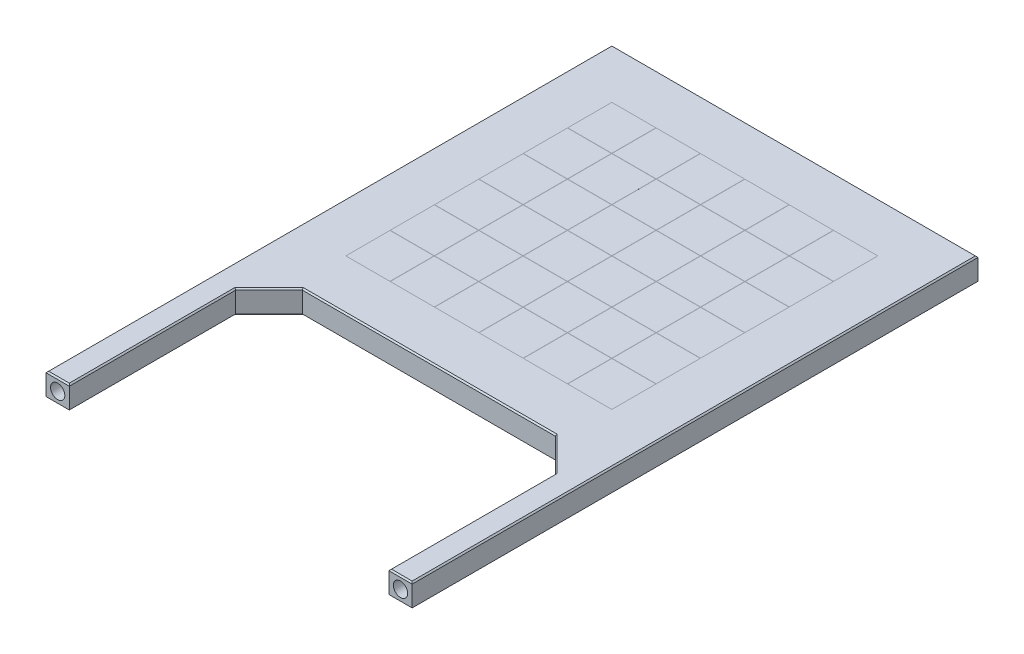
from build123d import *

# Parameters (mm, degrees)
SKETCH1_W              = 110
SKETCH1_H              = 110
BOSS_EXTRUDE1_DEPTH    = 7
SKETCH2_W              = 7
SKETCH2_H              = 60
BOSS_EXTRUDE3_DEPTH    = 7
SKETCH4_R              = 2.15
CUT_EXTRUDE2_DEPTH     = 10
SKETCH7_W              = 13.253333333
SKETCH7_H              = 13.253333333
CUT_EXTRUDE3_DEPTH     = 1
SKETCH7_2_W            = 13.253333333
SKETCH7_2_H            = 13.253333333
BOSS_EXTRUDE4_DEPTH    = 1
BOSS_EXTRUDE4_2_DEPTH  = 1
BOSS_EXTRUDE4_3_DEPTH  = 1
BOSS_EXTRUDE4_4_DEPTH  = 1
BOSS_EXTRUDE4_5_DEPTH  = 1
BOSS_EXTRUDE4_6_DEPTH  = 1
BOSS_EXTRUDE4_7_DEPTH  = 1
BOSS_EXTRUDE4_8_DEPTH  = 1
BOSS_EXTRUDE4_9_DEPTH  = 1
BOSS_EXTRUDE4_10_DEPTH = 1
BOSS_EXTRUDE4_11_DEPTH = 1
BOSS_EXTRUDE4_12_DEPTH = 1
BOSS_EXTRUDE4_13_DEPTH = 1
BOSS_EXTRUDE4_14_DEPTH = 1
BOSS_EXTRUDE4_15_DEPTH = 1
BOSS_EXTRUDE4_16_DEPTH = 1
BOSS_EXTRUDE4_17_DEPTH = 1
BOSS_EXTRUDE4_18_DEPTH = 1
BOSS_EXTRUDE4_19_DEPTH = 1
BOSS_EXTRUDE4_20_DEPTH = 1
BOSS_EXTRUDE4_21_DEPTH = 1
BOSS_EXTRUDE4_22_DEPTH = 1
BOSS_EXTRUDE4_23_DEPTH = 1
BOSS_EXTRUDE4_24_DEPTH = 1
BOSS_EXTRUDE4_25_DEPTH = 1
BOSS_EXTRUDE4_26_DEPTH = 1
BOSS_EXTRUDE4_27_DEPTH = 1
BOSS_EXTRUDE4_28_DEPTH = 1
BOSS_EXTRUDE4_29_DEPTH = 1
BOSS_EXTRUDE4_30_DEPTH = 1
BOSS_EXTRUDE4_31_DEPTH = 1
BOSS_EXTRUDE4_32_DEPTH = 1
BOSS_EXTRUDE4_33_DEPTH = 1
BOSS_EXTRUDE4_34_DEPTH = 1
BOSS_EXTRUDE4_35_DEPTH = 1
BOSS_EXTRUDE4_36_DEPTH = 1
CUT_EXTRUDE4_START     = -7
SKETCH7_3_W            = 13.253333333
SKETCH7_3_H            = 13.253333333
CUT_EXTRUDE4_DEPTH     = 1
BOSS_EXTRUDE5_START    = -7
SKETCH7_4_W            = 13.253333333
SKETCH7_4_H            = 13.253333333
BOSS_EXTRUDE5_DEPTH    = 1
BOSS_EXTRUDE5_2_DEPTH  = 1
BOSS_EXTRUDE5_3_DEPTH  = 1
BOSS_EXTRUDE5_4_DEPTH  = 1
BOSS_EXTRUDE5_5_DEPTH  = 1
BOSS_EXTRUDE5_6_DEPTH  = 1
BOSS_EXTRUDE5_7_DEPTH  = 1
BOSS_EXTRUDE5_8_DEPTH  = 1
BOSS_EXTRUDE5_9_DEPTH  = 1
BOSS_EXTRUDE5_10_DEPTH = 1
BOSS_EXTRUDE5_11_DEPTH = 1
BOSS_EXTRUDE5_12_DEPTH = 1
BOSS_EXTRUDE5_13_DEPTH = 1
BOSS_EXTRUDE5_14_DEPTH = 1
BOSS_EXTRUDE5_15_DEPTH = 1
BOSS_EXTRUDE5_16_DEPTH = 1
BOSS_EXTRUDE5_17_DEPTH = 1
BOSS_EXTRUDE5_18_DEPTH = 1
BOSS_EXTRUDE5_19_DEPTH = 1
BOSS_EXTRUDE5_20_DEPTH = 1
BOSS_EXTRUDE5_21_DEPTH = 1
BOSS_EXTRUDE5_22_DEPTH = 1
BOSS_EXTRUDE5_23_DEPTH = 1
BOSS_EXTRUDE5_24_DEPTH = 1
BOSS_EXTRUDE5_25_DEPTH = 1
BOSS_EXTRUDE5_26_DEPTH = 1
BOSS_EXTRUDE5_27_DEPTH = 1
BOSS_EXTRUDE5_28_DEPTH = 1
BOSS_EXTRUDE5_29_DEPTH = 1
BOSS_EXTRUDE5_30_DEPTH = 1
BOSS_EXTRUDE5_31_DEPTH = 1
BOSS_EXTRUDE5_32_DEPTH = 1
BOSS_EXTRUDE5_33_DEPTH = 1
BOSS_EXTRUDE5_34_DEPTH = 1
BOSS_EXTRUDE5_35_DEPTH = 1
BOSS_EXTRUDE5_36_DEPTH = 1
CHAMFER1_SIZE          = 10
CHAMFER2_SIZE          = 0.4


with BuildPart() as part:
    # Sketch1 → Boss-Extrude1 (new body)
    with BuildSketch(Plane(origin=(0, 0, 0), x_dir=(1, 0, 0), z_dir=(0, 1, 0))):
        Rectangle(SKETCH1_W, SKETCH1_H)
    extrude(amount=BOSS_EXTRUDE1_DEPTH)

    # Sketch2 → Boss-Extrude3 (add)
    with BuildSketch(Plane(origin=(0, 7, 0), x_dir=(1, 0, 0), z_dir=(0, 1, 0))):
        with Locations((-51.5, -85)):
            Rectangle(SKETCH2_W, SKETCH2_H)
        with Locations((51.5, -85)):
            Rectangle(SKETCH2_W, SKETCH2_H)
    extrude(amount=-BOSS_EXTRUDE3_DEPTH)

    # Sketch4 → Cut-Extrude2 (cut)
    with BuildSketch(Plane.XY.offset(115)):
        with Locations((-51.5, 3.5)):
            Circle(SKETCH4_R)
        with Locations((51.5, 3.5)):
            Circle(SKETCH4_R)
    extrude(amount=-CUT_EXTRUDE2_DEPTH, mode=Mode.SUBTRACT)

    # Sketch7 → Cut-Extrude3 (cut)
    with BuildSketch(Plane.XZ):
        with Locations((-20.003333334, 33.333333334)):
            Rectangle(SKETCH7_W, SKETCH7_H)
        with Locations((-33.333333334, 33.333333334)):
            Rectangle(SKETCH7_W, SKETCH7_H)
        with Locations((-6.673333334, 33.333333334)):
            Rectangle(SKETCH7_W, SKETCH7_H)
        with Locations((6.656666667, 33.333333334)):
            Rectangle(SKETCH7_W, SKETCH7_H)
        with Locations((19.986666666, 33.333333334)):
            Rectangle(SKETCH7_W, SKETCH7_H)
        with Locations((33.316666667, 33.333333334)):
            Rectangle(SKETCH7_W, SKETCH7_H)
        with Locations((-20.003333334, 20.003333334)):
            Rectangle(SKETCH7_W, SKETCH7_H)
        with Locations((-6.673333334, 20.003333334)):
            Rectangle(SKETCH7_W, SKETCH7_H)
        with Locations((6.656666667, 20.003333334)):
            Rectangle(SKETCH7_W, SKETCH7_H)
        with Locations((19.986666666, 20.003333334)):
            Rectangle(SKETCH7_W, SKETCH7_H)
        with Locations((33.316666667, 20.003333334)):
            Rectangle(SKETCH7_W, SKETCH7_H)
        with Locations((-20.003333334, 6.673333334)):
            Rectangle(SKETCH7_W, SKETCH7_H)
        with Locations((-6.673333334, 6.673333334)):
            Rectangle(SKETCH7_W, SKETCH7_H)
        with Locations((6.656666667, 6.673333334)):
            Rectangle(SKETCH7_W, SKETCH7_H)
        with Locations((19.986666666, 6.673333334)):
            Rectangle(SKETCH7_W, SKETCH7_H)
        with Locations((33.316666667, 6.673333334)):
            Rectangle(SKETCH7_W, SKETCH7_H)
        with Locations((-20.003333334, -6.656666667)):
            Rectangle(SKETCH7_W, SKETCH7_H)
        with Locations((-6.673333334, -6.656666667)):
            Rectangle(SKETCH7_W, SKETCH7_H)
        with Locations((6.656666667, -6.656666667)):
            Rectangle(SKETCH7_W, SKETCH7_H)
        with Locations((19.986666666, -6.656666667)):
            Rectangle(SKETCH7_W, SKETCH7_H)
        with Locations((33.316666667, -6.656666667)):
            Rectangle(SKETCH7_W, SKETCH7_H)
        with Locations((-20.003333334, -19.986666666)):
            Rectangle(SKETCH7_W, SKETCH7_H)
        with Locations((-6.673333334, -19.986666666)):
            Rectangle(SKETCH7_W, SKETCH7_H)
        with Locations((6.656666667, -19.986666666)):
            Rectangle(SKETCH7_W, SKETCH7_H)
        with Locations((19.986666666, -19.986666666)):
            Rectangle(SKETCH7_W, SKETCH7_H)
        with Locations((33.316666667, -19.986666666)):
            Rectangle(SKETCH7_W, SKETCH7_H)
        with Locations((-20.003333334, -33.316666667)):
            Rectangle(SKETCH7_W, SKETCH7_H)
        with Locations((-6.673333334, -33.316666667)):
            Rectangle(SKETCH7_W, SKETCH7_H)
        with Locations((6.656666667, -33.316666667)):
            Rectangle(SKETCH7_W, SKETCH7_H)
        with Locations((19.986666666, -33.316666667)):
            Rectangle(SKETCH7_W, SKETCH7_H)
        with Locations((33.316666667, -33.316666667)):
            Rectangle(SKETCH7_W, SKETCH7_H)
        with Locations((-33.333333334, 20.003333334)):
            Rectangle(SKETCH7_W, SKETCH7_H)
        with Locations((-33.333333334, 6.673333334)):
            Rectangle(SKETCH7_W, SKETCH7_H)
        with Locations((-33.333333334, -6.656666667)):
            Rectangle(SKETCH7_W, SKETCH7_H)
        with Locations((-33.333333334, -19.986666666)):
            Rectangle(SKETCH7_W, SKETCH7_H)
        with Locations((-33.333333334, -33.316666667)):
            Rectangle(SKETCH7_W, SKETCH7_H)
    extrude(amount=-CUT_EXTRUDE3_DEPTH, mode=Mode.SUBTRACT)

    # Sketch7<3> → Cut-Extrude4 (cut)
    with BuildSketch(Plane.XZ.offset(CUT_EXTRUDE4_START)):
        with Locations((-20.003333334, 33.333333334)):
            Rectangle(SKETCH7_3_W, SKETCH7_3_H)
        with Locations((-33.333333334, 33.333333334)):
            Rectangle(SKETCH7_3_W, SKETCH7_3_H)
        with Locations((-6.673333334, 33.333333334)):
            Rectangle(SKETCH7_3_W, SKETCH7_3_H)
        with Locations((6.656666667, 33.333333334)):
            Rectangle(SKETCH7_3_W, SKETCH7_3_H)
        with Locations((19.986666666, 33.333333334)):
            Rectangle(SKETCH7_3_W, SKETCH7_3_H)
        with Locations((33.316666667, 33.333333334)):
            Rectangle(SKETCH7_3_W, SKETCH7_3_H)
        with Locations((-20.003333334, 20.003333334)):
            Rectangle(SKETCH7_3_W, SKETCH7_3_H)
        with Locations((-6.673333334, 20.003333334)):
            Rectangle(SKETCH7_3_W, SKETCH7_3_H)
        with Locations((6.656666667, 20.003333334)):
            Rectangle(SKETCH7_3_W, SKETCH7_3_H)
        with Locations((19.986666666, 20.003333334)):
            Rectangle(SKETCH7_3_W, SKETCH7_3_H)
        with Locations((33.316666667, 20.003333334)):
            Rectangle(SKETCH7_3_W, SKETCH7_3_H)
        with Locations((-20.003333334, 6.673333334)):
            Rectangle(SKETCH7_3_W, SKETCH7_3_H)
        with Locations((-6.673333334, 6.673333334)):
            Rectangle(SKETCH7_3_W, SKETCH7_3_H)
        with Locations((6.656666667, 6.673333334)):
            Rectangle(SKETCH7_3_W, SKETCH7_3_H)
        with Locations((19.986666666, 6.673333334)):
            Rectangle(SKETCH7_3_W, SKETCH7_3_H)
        with Locations((33.316666667, 6.673333334)):
            Rectangle(SKETCH7_3_W, SKETCH7_3_H)
        with Locations((-20.003333334, -6.656666667)):
            Rectangle(SKETCH7_3_W, SKETCH7_3_H)
        with Locations((-6.673333334, -6.656666667)):
            Rectangle(SKETCH7_3_W, SKETCH7_3_H)
        with Locations((6.656666667, -6.656666667)):
            Rectangle(SKETCH7_3_W, SKETCH7_3_H)
        with Locations((19.986666666, -6.656666667)):
            Rectangle(SKETCH7_3_W, SKETCH7_3_H)
        with Locations((33.316666667, -6.656666667)):
            Rectangle(SKETCH7_3_W, SKETCH7_3_H)
        with Locations((-20.003333334, -19.986666666)):
            Rectangle(SKETCH7_3_W, SKETCH7_3_H)
        with Locations((-6.673333334, -19.986666666)):
            Rectangle(SKETCH7_3_W, SKETCH7_3_H)
        with Locations((6.656666667, -19.986666666)):
            Rectangle(SKETCH7_3_W, SKETCH7_3_H)
        with Locations((19.986666666, -19.986666666)):
            Rectangle(SKETCH7_3_W, SKETCH7_3_H)
        with Locations((33.316666667, -19.986666666)):
            Rectangle(SKETCH7_3_W, SKETCH7_3_H)
        with Locations((-20.003333334, -33.316666667)):
            Rectangle(SKETCH7_3_W, SKETCH7_3_H)
        with Locations((-6.673333334, -33.316666667)):
            Rectangle(SKETCH7_3_W, SKETCH7_3_H)
        with Locations((6.656666667, -33.316666667)):
            Rectangle(SKETCH7_3_W, SKETCH7_3_H)
        with Locations((19.986666666, -33.316666667)):
            Rectangle(SKETCH7_3_W, SKETCH7_3_H)
        with Locations((33.316666667, -33.316666667)):
            Rectangle(SKETCH7_3_W, SKETCH7_3_H)
        with Locations((-33.333333334, 20.003333334)):
            Rectangle(SKETCH7_3_W, SKETCH7_3_H)
        with Locations((-33.333333334, 6.673333334)):
            Rectangle(SKETCH7_3_W, SKETCH7_3_H)
        with Locations((-33.333333334, -6.656666667)):
            Rectangle(SKETCH7_3_W, SKETCH7_3_H)
        with Locations((-33.333333334, -19.986666666)):
            Rectangle(SKETCH7_3_W, SKETCH7_3_H)
        with Locations((-33.333333334, -33.316666667)):
            Rectangle(SKETCH7_3_W, SKETCH7_3_H)
    extrude(amount=CUT_EXTRUDE4_DEPTH, mode=Mode.SUBTRACT)

    # Chamfer1
    chamfer1_edges = [part.edges().sort_by_distance(p)[0] for p in [
        (-48, 3.5, 55),
        (48, 3.5, 55),
    ]]
    chamfer(chamfer1_edges, length=CHAMFER1_SIZE)

    # Chamfer2
    chamfer2_edges = [part.edges().sort_by_distance(p)[0] for p in [
        (-55, 7, 30),
        (-51.5, 7, 115),
        (-48, 7, 90),
        (-51.5, 0, 115),
        (-48, 0, 90),
        (51.5, 7, 115),
        (51.5, 0, 115),
        (55, 7, 30),
        (-55, 0, 30),
        (0, 0, -55),
        (55, 0, 30),
        (0, 7, -55),
        (0, 0, 55),
        (0, 7, 55),
        (48, 0, 90),
        (48, 7, 90),
        (-43, 7, 60),
        (-43, 0, 60),
        (43, 7, 60),
        (43, 0, 60),
    ]]
    chamfer(chamfer2_edges, length=CHAMFER2_SIZE)


with BuildPart() as body_2:
    # Sketch7<2> → Boss-Extrude4 (new body)
    with BuildSketch(Plane.XZ):
        with Locations((-20.003333334, 33.333333334)):
            Rectangle(SKETCH7_2_W, SKETCH7_2_H)
    extrude(amount=-BOSS_EXTRUDE4_DEPTH)


with BuildPart() as body_3:
    # Sketch7<2> → Boss-Extrude4 2 (new body)
    with BuildSketch(Plane.XZ):
        with Locations((-33.333333334, 33.333333334)):
            Rectangle(SKETCH7_2_W, SKETCH7_2_H)
    extrude(amount=-BOSS_EXTRUDE4_2_DEPTH)


with BuildPart() as body_4:
    # Sketch7<2> → Boss-Extrude4 3 (new body)
    with BuildSketch(Plane.XZ):
        with Locations((-6.673333334, 33.333333334)):
            Rectangle(SKETCH7_2_W, SKETCH7_2_H)
    extrude(amount=-BOSS_EXTRUDE4_3_DEPTH)


with BuildPart() as body_5:
    # Sketch7<2> → Boss-Extrude4 4 (new body)
    with BuildSketch(Plane.XZ):
        with Locations((6.656666667, 33.333333334)):
            Rectangle(SKETCH7_2_W, SKETCH7_2_H)
    extrude(amount=-BOSS_EXTRUDE4_4_DEPTH)


with BuildPart() as body_6:
    # Sketch7<2> → Boss-Extrude4 5 (new body)
    with BuildSketch(Plane.XZ):
        with Locations((19.986666666, 33.333333334)):
            Rectangle(SKETCH7_2_W, SKETCH7_2_H)
    extrude(amount=-BOSS_EXTRUDE4_5_DEPTH)


with BuildPart() as body_7:
    # Sketch7<2> → Boss-Extrude4 6 (new body)
    with BuildSketch(Plane.XZ):
        with Locations((33.316666667, 33.333333334)):
            Rectangle(SKETCH7_2_W, SKETCH7_2_H)
    extrude(amount=-BOSS_EXTRUDE4_6_DEPTH)


with BuildPart() as body_8:
    # Sketch7<2> → Boss-Extrude4 7 (new body)
    with BuildSketch(Plane.XZ):
        with Locations((-20.003333334, 20.003333334)):
            Rectangle(SKETCH7_2_W, SKETCH7_2_H)
    extrude(amount=-BOSS_EXTRUDE4_7_DEPTH)


with BuildPart() as body_9:
    # Sketch7<2> → Boss-Extrude4 8 (new body)
    with BuildSketch(Plane.XZ):
        with Locations((-6.673333334, 20.003333334)):
            Rectangle(SKETCH7_2_W, SKETCH7_2_H)
    extrude(amount=-BOSS_EXTRUDE4_8_DEPTH)


with BuildPart() as body_10:
    # Sketch7<2> → Boss-Extrude4 9 (new body)
    with BuildSketch(Plane.XZ):
        with Locations((6.656666667, 20.003333334)):
            Rectangle(SKETCH7_2_W, SKETCH7_2_H)
    extrude(amount=-BOSS_EXTRUDE4_9_DEPTH)


with BuildPart() as body_11:
    # Sketch7<2> → Boss-Extrude4 10 (new body)
    with BuildSketch(Plane.XZ):
        with Locations((19.986666666, 20.003333334)):
            Rectangle(SKETCH7_2_W, SKETCH7_2_H)
    extrude(amount=-BOSS_EXTRUDE4_10_DEPTH)


with BuildPart() as body_12:
    # Sketch7<2> → Boss-Extrude4 11 (new body)
    with BuildSketch(Plane.XZ):
        with Locations((33.316666667, 20.003333334)):
            Rectangle(SKETCH7_2_W, SKETCH7_2_H)
    extrude(amount=-BOSS_EXTRUDE4_11_DEPTH)


with BuildPart() as body_13:
    # Sketch7<2> → Boss-Extrude4 12 (new body)
    with BuildSketch(Plane.XZ):
        with Locations((-20.003333334, 6.673333334)):
            Rectangle(SKETCH7_2_W, SKETCH7_2_H)
    extrude(amount=-BOSS_EXTRUDE4_12_DEPTH)


with BuildPart() as body_14:
    # Sketch7<2> → Boss-Extrude4 13 (new body)
    with BuildSketch(Plane.XZ):
        with Locations((-6.673333334, 6.673333334)):
            Rectangle(SKETCH7_2_W, SKETCH7_2_H)
    extrude(amount=-BOSS_EXTRUDE4_13_DEPTH)


with BuildPart() as body_15:
    # Sketch7<2> → Boss-Extrude4 14 (new body)
    with BuildSketch(Plane.XZ):
        with Locations((6.656666667, 6.673333334)):
            Rectangle(SKETCH7_2_W, SKETCH7_2_H)
    extrude(amount=-BOSS_EXTRUDE4_14_DEPTH)


with BuildPart() as body_16:
    # Sketch7<2> → Boss-Extrude4 15 (new body)
    with BuildSketch(Plane.XZ):
        with Locations((19.986666666, 6.673333334)):
            Rectangle(SKETCH7_2_W, SKETCH7_2_H)
    extrude(amount=-BOSS_EXTRUDE4_15_DEPTH)


with BuildPart() as body_17:
    # Sketch7<2> → Boss-Extrude4 16 (new body)
    with BuildSketch(Plane.XZ):
        with Locations((33.316666667, 6.673333334)):
            Rectangle(SKETCH7_2_W, SKETCH7_2_H)
    extrude(amount=-BOSS_EXTRUDE4_16_DEPTH)


with BuildPart() as body_18:
    # Sketch7<2> → Boss-Extrude4 17 (new body)
    with BuildSketch(Plane.XZ):
        with Locations((-20.003333334, -6.656666667)):
            Rectangle(SKETCH7_2_W, SKETCH7_2_H)
    extrude(amount=-BOSS_EXTRUDE4_17_DEPTH)


with BuildPart() as body_19:
    # Sketch7<2> → Boss-Extrude4 18 (new body)
    with BuildSketch(Plane.XZ):
        with Locations((-6.673333334, -6.656666667)):
            Rectangle(SKETCH7_2_W, SKETCH7_2_H)
    extrude(amount=-BOSS_EXTRUDE4_18_DEPTH)


with BuildPart() as body_20:
    # Sketch7<2> → Boss-Extrude4 19 (new body)
    with BuildSketch(Plane.XZ):
        with Locations((6.656666667, -6.656666667)):
            Rectangle(SKETCH7_2_W, SKETCH7_2_H)
    extrude(amount=-BOSS_EXTRUDE4_19_DEPTH)


with BuildPart() as body_21:
    # Sketch7<2> → Boss-Extrude4 20 (new body)
    with BuildSketch(Plane.XZ):
        with Locations((19.986666666, -6.656666667)):
            Rectangle(SKETCH7_2_W, SKETCH7_2_H)
    extrude(amount=-BOSS_EXTRUDE4_20_DEPTH)


with BuildPart() as body_22:
    # Sketch7<2> → Boss-Extrude4 21 (new body)
    with BuildSketch(Plane.XZ):
        with Locations((33.316666667, -6.656666667)):
            Rectangle(SKETCH7_2_W, SKETCH7_2_H)
    extrude(amount=-BOSS_EXTRUDE4_21_DEPTH)


with BuildPart() as body_23:
    # Sketch7<2> → Boss-Extrude4 22 (new body)
    with BuildSketch(Plane.XZ):
        with Locations((-20.003333334, -19.986666666)):
            Rectangle(SKETCH7_2_W, SKETCH7_2_H)
    extrude(amount=-BOSS_EXTRUDE4_22_DEPTH)


with BuildPart() as body_24:
    # Sketch7<2> → Boss-Extrude4 23 (new body)
    with BuildSketch(Plane.XZ):
        with Locations((-6.673333334, -19.986666666)):
            Rectangle(SKETCH7_2_W, SKETCH7_2_H)
    extrude(amount=-BOSS_EXTRUDE4_23_DEPTH)


with BuildPart() as body_25:
    # Sketch7<2> → Boss-Extrude4 24 (new body)
    with BuildSketch(Plane.XZ):
        with Locations((6.656666667, -19.986666666)):
            Rectangle(SKETCH7_2_W, SKETCH7_2_H)
    extrude(amount=-BOSS_EXTRUDE4_24_DEPTH)


with BuildPart() as body_26:
    # Sketch7<2> → Boss-Extrude4 25 (new body)
    with BuildSketch(Plane.XZ):
        with Locations((19.986666666, -19.986666666)):
            Rectangle(SKETCH7_2_W, SKETCH7_2_H)
    extrude(amount=-BOSS_EXTRUDE4_25_DEPTH)


with BuildPart() as body_27:
    # Sketch7<2> → Boss-Extrude4 26 (new body)
    with BuildSketch(Plane.XZ):
        with Locations((33.316666667, -19.986666666)):
            Rectangle(SKETCH7_2_W, SKETCH7_2_H)
    extrude(amount=-BOSS_EXTRUDE4_26_DEPTH)


with BuildPart() as body_28:
    # Sketch7<2> → Boss-Extrude4 27 (new body)
    with BuildSketch(Plane.XZ):
        with Locations((-20.003333334, -33.316666667)):
            Rectangle(SKETCH7_2_W, SKETCH7_2_H)
    extrude(amount=-BOSS_EXTRUDE4_27_DEPTH)


with BuildPart() as body_29:
    # Sketch7<2> → Boss-Extrude4 28 (new body)
    with BuildSketch(Plane.XZ):
        with Locations((-6.673333334, -33.316666667)):
            Rectangle(SKETCH7_2_W, SKETCH7_2_H)
    extrude(amount=-BOSS_EXTRUDE4_28_DEPTH)


with BuildPart() as body_30:
    # Sketch7<2> → Boss-Extrude4 29 (new body)
    with BuildSketch(Plane.XZ):
        with Locations((6.656666667, -33.316666667)):
            Rectangle(SKETCH7_2_W, SKETCH7_2_H)
    extrude(amount=-BOSS_EXTRUDE4_29_DEPTH)


with BuildPart() as body_31:
    # Sketch7<2> → Boss-Extrude4 30 (new body)
    with BuildSketch(Plane.XZ):
        with Locations((19.986666666, -33.316666667)):
            Rectangle(SKETCH7_2_W, SKETCH7_2_H)
    extrude(amount=-BOSS_EXTRUDE4_30_DEPTH)


with BuildPart() as body_32:
    # Sketch7<2> → Boss-Extrude4 31 (new body)
    with BuildSketch(Plane.XZ):
        with Locations((33.316666667, -33.316666667)):
            Rectangle(SKETCH7_2_W, SKETCH7_2_H)
    extrude(amount=-BOSS_EXTRUDE4_31_DEPTH)


with BuildPart() as body_33:
    # Sketch7<2> → Boss-Extrude4 32 (new body)
    with BuildSketch(Plane.XZ):
        with Locations((-33.333333334, 20.003333334)):
            Rectangle(SKETCH7_2_W, SKETCH7_2_H)
    extrude(amount=-BOSS_EXTRUDE4_32_DEPTH)


with BuildPart() as body_34:
    # Sketch7<2> → Boss-Extrude4 33 (new body)
    with BuildSketch(Plane.XZ):
        with Locations((-33.333333334, 6.673333334)):
            Rectangle(SKETCH7_2_W, SKETCH7_2_H)
    extrude(amount=-BOSS_EXTRUDE4_33_DEPTH)


with BuildPart() as body_35:
    # Sketch7<2> → Boss-Extrude4 34 (new body)
    with BuildSketch(Plane.XZ):
        with Locations((-33.333333334, -6.656666667)):
            Rectangle(SKETCH7_2_W, SKETCH7_2_H)
    extrude(amount=-BOSS_EXTRUDE4_34_DEPTH)


with BuildPart() as body_36:
    # Sketch7<2> → Boss-Extrude4 35 (new body)
    with BuildSketch(Plane.XZ):
        with Locations((-33.333333334, -19.986666666)):
            Rectangle(SKETCH7_2_W, SKETCH7_2_H)
    extrude(amount=-BOSS_EXTRUDE4_35_DEPTH)


with BuildPart() as body_37:
    # Sketch7<2> → Boss-Extrude4 36 (new body)
    with BuildSketch(Plane.XZ):
        with Locations((-33.333333334, -33.316666667)):
            Rectangle(SKETCH7_2_W, SKETCH7_2_H)
    extrude(amount=-BOSS_EXTRUDE4_36_DEPTH)


with BuildPart() as body_38:
    # Sketch7<4> → Boss-Extrude5 (new body)
    with BuildSketch(Plane.XZ.offset(BOSS_EXTRUDE5_START)):
        with Locations((-20.003333334, 33.333333334)):
            Rectangle(SKETCH7_4_W, SKETCH7_4_H)
    extrude(amount=BOSS_EXTRUDE5_DEPTH)


with BuildPart() as body_39:
    # Sketch7<4> → Boss-Extrude5 2 (new body)
    with BuildSketch(Plane.XZ.offset(BOSS_EXTRUDE5_START)):
        with Locations((-33.333333334, 33.333333334)):
            Rectangle(SKETCH7_4_W, SKETCH7_4_H)
    extrude(amount=BOSS_EXTRUDE5_2_DEPTH)


with BuildPart() as body_40:
    # Sketch7<4> → Boss-Extrude5 3 (new body)
    with BuildSketch(Plane.XZ.offset(BOSS_EXTRUDE5_START)):
        with Locations((-6.673333334, 33.333333334)):
            Rectangle(SKETCH7_4_W, SKETCH7_4_H)
    extrude(amount=BOSS_EXTRUDE5_3_DEPTH)


with BuildPart() as body_41:
    # Sketch7<4> → Boss-Extrude5 4 (new body)
    with BuildSketch(Plane.XZ.offset(BOSS_EXTRUDE5_START)):
        with Locations((6.656666667, 33.333333334)):
            Rectangle(SKETCH7_4_W, SKETCH7_4_H)
    extrude(amount=BOSS_EXTRUDE5_4_DEPTH)


with BuildPart() as body_42:
    # Sketch7<4> → Boss-Extrude5 5 (new body)
    with BuildSketch(Plane.XZ.offset(BOSS_EXTRUDE5_START)):
        with Locations((19.986666666, 33.333333334)):
            Rectangle(SKETCH7_4_W, SKETCH7_4_H)
    extrude(amount=BOSS_EXTRUDE5_5_DEPTH)


with BuildPart() as body_43:
    # Sketch7<4> → Boss-Extrude5 6 (new body)
    with BuildSketch(Plane.XZ.offset(BOSS_EXTRUDE5_START)):
        with Locations((33.316666667, 33.333333334)):
            Rectangle(SKETCH7_4_W, SKETCH7_4_H)
    extrude(amount=BOSS_EXTRUDE5_6_DEPTH)


with BuildPart() as body_44:
    # Sketch7<4> → Boss-Extrude5 7 (new body)
    with BuildSketch(Plane.XZ.offset(BOSS_EXTRUDE5_START)):
        with Locations((-20.003333334, 20.003333334)):
            Rectangle(SKETCH7_4_W, SKETCH7_4_H)
    extrude(amount=BOSS_EXTRUDE5_7_DEPTH)


with BuildPart() as body_45:
    # Sketch7<4> → Boss-Extrude5 8 (new body)
    with BuildSketch(Plane.XZ.offset(BOSS_EXTRUDE5_START)):
        with Locations((-6.673333334, 20.003333334)):
            Rectangle(SKETCH7_4_W, SKETCH7_4_H)
    extrude(amount=BOSS_EXTRUDE5_8_DEPTH)


with BuildPart() as body_46:
    # Sketch7<4> → Boss-Extrude5 9 (new body)
    with BuildSketch(Plane.XZ.offset(BOSS_EXTRUDE5_START)):
        with Locations((6.656666667, 20.003333334)):
            Rectangle(SKETCH7_4_W, SKETCH7_4_H)
    extrude(amount=BOSS_EXTRUDE5_9_DEPTH)


with BuildPart() as body_47:
    # Sketch7<4> → Boss-Extrude5 10 (new body)
    with BuildSketch(Plane.XZ.offset(BOSS_EXTRUDE5_START)):
        with Locations((19.986666666, 20.003333334)):
            Rectangle(SKETCH7_4_W, SKETCH7_4_H)
    extrude(amount=BOSS_EXTRUDE5_10_DEPTH)


with BuildPart() as body_48:
    # Sketch7<4> → Boss-Extrude5 11 (new body)
    with BuildSketch(Plane.XZ.offset(BOSS_EXTRUDE5_START)):
        with Locations((33.316666667, 20.003333334)):
            Rectangle(SKETCH7_4_W, SKETCH7_4_H)
    extrude(amount=BOSS_EXTRUDE5_11_DEPTH)


with BuildPart() as body_49:
    # Sketch7<4> → Boss-Extrude5 12 (new body)
    with BuildSketch(Plane.XZ.offset(BOSS_EXTRUDE5_START)):
        with Locations((-20.003333334, 6.673333334)):
            Rectangle(SKETCH7_4_W, SKETCH7_4_H)
    extrude(amount=BOSS_EXTRUDE5_12_DEPTH)


with BuildPart() as body_50:
    # Sketch7<4> → Boss-Extrude5 13 (new body)
    with BuildSketch(Plane.XZ.offset(BOSS_EXTRUDE5_START)):
        with Locations((-6.673333334, 6.673333334)):
            Rectangle(SKETCH7_4_W, SKETCH7_4_H)
    extrude(amount=BOSS_EXTRUDE5_13_DEPTH)


with BuildPart() as body_51:
    # Sketch7<4> → Boss-Extrude5 14 (new body)
    with BuildSketch(Plane.XZ.offset(BOSS_EXTRUDE5_START)):
        with Locations((6.656666667, 6.673333334)):
            Rectangle(SKETCH7_4_W, SKETCH7_4_H)
    extrude(amount=BOSS_EXTRUDE5_14_DEPTH)


with BuildPart() as body_52:
    # Sketch7<4> → Boss-Extrude5 15 (new body)
    with BuildSketch(Plane.XZ.offset(BOSS_EXTRUDE5_START)):
        with Locations((19.986666666, 6.673333334)):
            Rectangle(SKETCH7_4_W, SKETCH7_4_H)
    extrude(amount=BOSS_EXTRUDE5_15_DEPTH)


with BuildPart() as body_53:
    # Sketch7<4> → Boss-Extrude5 16 (new body)
    with BuildSketch(Plane.XZ.offset(BOSS_EXTRUDE5_START)):
        with Locations((33.316666667, 6.673333334)):
            Rectangle(SKETCH7_4_W, SKETCH7_4_H)
    extrude(amount=BOSS_EXTRUDE5_16_DEPTH)


with BuildPart() as body_54:
    # Sketch7<4> → Boss-Extrude5 17 (new body)
    with BuildSketch(Plane.XZ.offset(BOSS_EXTRUDE5_START)):
        with Locations((-20.003333334, -6.656666667)):
            Rectangle(SKETCH7_4_W, SKETCH7_4_H)
    extrude(amount=BOSS_EXTRUDE5_17_DEPTH)


with BuildPart() as body_55:
    # Sketch7<4> → Boss-Extrude5 18 (new body)
    with BuildSketch(Plane.XZ.offset(BOSS_EXTRUDE5_START)):
        with Locations((-6.673333334, -6.656666667)):
            Rectangle(SKETCH7_4_W, SKETCH7_4_H)
    extrude(amount=BOSS_EXTRUDE5_18_DEPTH)


with BuildPart() as body_56:
    # Sketch7<4> → Boss-Extrude5 19 (new body)
    with BuildSketch(Plane.XZ.offset(BOSS_EXTRUDE5_START)):
        with Locations((6.656666667, -6.656666667)):
            Rectangle(SKETCH7_4_W, SKETCH7_4_H)
    extrude(amount=BOSS_EXTRUDE5_19_DEPTH)


with BuildPart() as body_57:
    # Sketch7<4> → Boss-Extrude5 20 (new body)
    with BuildSketch(Plane.XZ.offset(BOSS_EXTRUDE5_START)):
        with Locations((19.986666666, -6.656666667)):
            Rectangle(SKETCH7_4_W, SKETCH7_4_H)
    extrude(amount=BOSS_EXTRUDE5_20_DEPTH)


with BuildPart() as body_58:
    # Sketch7<4> → Boss-Extrude5 21 (new body)
    with BuildSketch(Plane.XZ.offset(BOSS_EXTRUDE5_START)):
        with Locations((33.316666667, -6.656666667)):
            Rectangle(SKETCH7_4_W, SKETCH7_4_H)
    extrude(amount=BOSS_EXTRUDE5_21_DEPTH)


with BuildPart() as body_59:
    # Sketch7<4> → Boss-Extrude5 22 (new body)
    with BuildSketch(Plane.XZ.offset(BOSS_EXTRUDE5_START)):
        with Locations((-20.003333334, -19.986666666)):
            Rectangle(SKETCH7_4_W, SKETCH7_4_H)
    extrude(amount=BOSS_EXTRUDE5_22_DEPTH)


with BuildPart() as body_60:
    # Sketch7<4> → Boss-Extrude5 23 (new body)
    with BuildSketch(Plane.XZ.offset(BOSS_EXTRUDE5_START)):
        with Locations((-6.673333334, -19.986666666)):
            Rectangle(SKETCH7_4_W, SKETCH7_4_H)
    extrude(amount=BOSS_EXTRUDE5_23_DEPTH)


with BuildPart() as body_61:
    # Sketch7<4> → Boss-Extrude5 24 (new body)
    with BuildSketch(Plane.XZ.offset(BOSS_EXTRUDE5_START)):
        with Locations((6.656666667, -19.986666666)):
            Rectangle(SKETCH7_4_W, SKETCH7_4_H)
    extrude(amount=BOSS_EXTRUDE5_24_DEPTH)


with BuildPart() as body_62:
    # Sketch7<4> → Boss-Extrude5 25 (new body)
    with BuildSketch(Plane.XZ.offset(BOSS_EXTRUDE5_START)):
        with Locations((19.986666666, -19.986666666)):
            Rectangle(SKETCH7_4_W, SKETCH7_4_H)
    extrude(amount=BOSS_EXTRUDE5_25_DEPTH)


with BuildPart() as body_63:
    # Sketch7<4> → Boss-Extrude5 26 (new body)
    with BuildSketch(Plane.XZ.offset(BOSS_EXTRUDE5_START)):
        with Locations((33.316666667, -19.986666666)):
            Rectangle(SKETCH7_4_W, SKETCH7_4_H)
    extrude(amount=BOSS_EXTRUDE5_26_DEPTH)


with BuildPart() as body_64:
    # Sketch7<4> → Boss-Extrude5 27 (new body)
    with BuildSketch(Plane.XZ.offset(BOSS_EXTRUDE5_START)):
        with Locations((-20.003333334, -33.316666667)):
            Rectangle(SKETCH7_4_W, SKETCH7_4_H)
    extrude(amount=BOSS_EXTRUDE5_27_DEPTH)


with BuildPart() as body_65:
    # Sketch7<4> → Boss-Extrude5 28 (new body)
    with BuildSketch(Plane.XZ.offset(BOSS_EXTRUDE5_START)):
        with Locations((-6.673333334, -33.316666667)):
            Rectangle(SKETCH7_4_W, SKETCH7_4_H)
    extrude(amount=BOSS_EXTRUDE5_28_DEPTH)


with BuildPart() as body_66:
    # Sketch7<4> → Boss-Extrude5 29 (new body)
    with BuildSketch(Plane.XZ.offset(BOSS_EXTRUDE5_START)):
        with Locations((6.656666667, -33.316666667)):
            Rectangle(SKETCH7_4_W, SKETCH7_4_H)
    extrude(amount=BOSS_EXTRUDE5_29_DEPTH)


with BuildPart() as body_67:
    # Sketch7<4> → Boss-Extrude5 30 (new body)
    with BuildSketch(Plane.XZ.offset(BOSS_EXTRUDE5_START)):
        with Locations((19.986666666, -33.316666667)):
            Rectangle(SKETCH7_4_W, SKETCH7_4_H)
    extrude(amount=BOSS_EXTRUDE5_30_DEPTH)


with BuildPart() as body_68:
    # Sketch7<4> → Boss-Extrude5 31 (new body)
    with BuildSketch(Plane.XZ.offset(BOSS_EXTRUDE5_START)):
        with Locations((33.316666667, -33.316666667)):
            Rectangle(SKETCH7_4_W, SKETCH7_4_H)
    extrude(amount=BOSS_EXTRUDE5_31_DEPTH)


with BuildPart() as body_69:
    # Sketch7<4> → Boss-Extrude5 32 (new body)
    with BuildSketch(Plane.XZ.offset(BOSS_EXTRUDE5_START)):
        with Locations((-33.333333334, 20.003333334)):
            Rectangle(SKETCH7_4_W, SKETCH7_4_H)
    extrude(amount=BOSS_EXTRUDE5_32_DEPTH)


with BuildPart() as body_70:
    # Sketch7<4> → Boss-Extrude5 33 (new body)
    with BuildSketch(Plane.XZ.offset(BOSS_EXTRUDE5_START)):
        with Locations((-33.333333334, 6.673333334)):
            Rectangle(SKETCH7_4_W, SKETCH7_4_H)
    extrude(amount=BOSS_EXTRUDE5_33_DEPTH)


with BuildPart() as body_71:
    # Sketch7<4> → Boss-Extrude5 34 (new body)
    with BuildSketch(Plane.XZ.offset(BOSS_EXTRUDE5_START)):
        with Locations((-33.333333334, -6.656666667)):
            Rectangle(SKETCH7_4_W, SKETCH7_4_H)
    extrude(amount=BOSS_EXTRUDE5_34_DEPTH)


with BuildPart() as body_72:
    # Sketch7<4> → Boss-Extrude5 35 (new body)
    with BuildSketch(Plane.XZ.offset(BOSS_EXTRUDE5_START)):
        with Locations((-33.333333334, -19.986666666)):
            Rectangle(SKETCH7_4_W, SKETCH7_4_H)
    extrude(amount=BOSS_EXTRUDE5_35_DEPTH)


with BuildPart() as body_73:
    # Sketch7<4> → Boss-Extrude5 36 (new body)
    with BuildSketch(Plane.XZ.offset(BOSS_EXTRUDE5_START)):
        with Locations((-33.333333334, -33.316666667)):
            Rectangle(SKETCH7_4_W, SKETCH7_4_H)
    extrude(amount=BOSS_EXTRUDE5_36_DEPTH)


solid = Compound([part.part, body_2.part, body_3.part, body_4.part, body_5.part, body_6.part, body_7.part, body_8.part, body_9.part, body_10.part, body_11.part, body_12.part, body_13.part, body_14.part, body_15.part, body_16.part, body_17.part, body_18.part, body_19.part, body_20.part, body_21.part, body_22.part, body_23.part, body_24.part, body_25.part, body_26.part, body_27.part, body_28.part, body_29.part, body_30.part, body_31.part, body_32.part, body_33.part, body_34.part, body_35.part, body_36.part, body_37.part, body_38.part, body_39.part, body_40.part, body_41.part, body_42.part, body_43.part, body_44.part, body_45.part, body_46.part, body_47.part, body_48.part, body_49.part, body_50.part, body_51.part, body_52.part, body_53.part, body_54.part, body_55.part, body_56.part, body_57.part, body_58.part, body_59.part, body_60.part, body_61.part, body_62.part, body_63.part, body_64.part, body_65.part, body_66.part, body_67.part, body_68.part, body_69.part, body_70.part, body_71.part, body_72.part, body_73.part])
